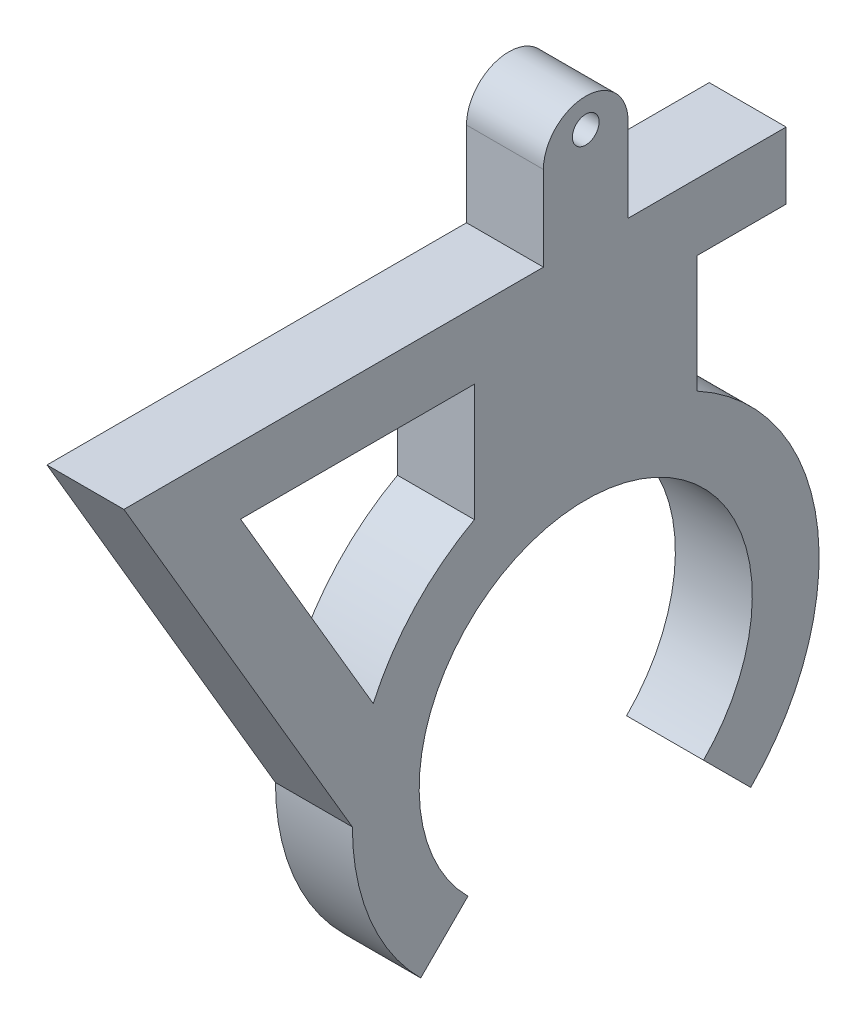
from build123d import *

# Parameters (mm, degrees)
SKETCH1_R           = 0.3
BOSS_EXTRUDE1_DEPTH = 1.7272


with BuildPart() as part:
    # Sketch1 → Boss-Extrude1 (new body)
    with BuildSketch(Plane(origin=(0, 0, 0), x_dir=(0, 0, -1), z_dir=(1, 0, 0))):
        with BuildLine():
            Line((-3.705239533, -3.705239533), (-2.644579362, -2.644579362))
            ThreePointArc((-2.644579362, -2.644579362), (0, 3.74), (2.644579362, -2.644579362))
            Line((2.644579362, -2.644579362), (3.705239533, -3.705239533))
            ThreePointArc((3.705239533, -3.705239533), (5.185747801, 0.752076956), (2.5, 4.605171007))
            Line((2.5, 4.605171007), (2.5, 7.24))
            Line((2.5, 7.24), (4.5, 7.24))
            Line((4.5, 7.24), (4.5, 8.74))
            Line((4.5, 8.74), (0.95, 8.74))
            Line((0.95, 8.74), (0.95, 10.64))
            ThreePointArc((0.95, 10.64), (0, 11.59), (-0.95, 10.64))
            Line((-0.95, 10.64), (-0.95, 8.74))
            Line((-0.95, 8.74), (-10.370093503, 8.74))
            Line((-10.370093503, 8.74), (-5.24, 0))
            ThreePointArc((-5.24, 0), (-4.84112875, -2.005261186), (-3.705239533, -3.705239533))
        make_face()
        with BuildLine():
            ThreePointArc((-2.5, 4.605171007), (-3.835037239, 3.570726729), (-4.771676297, 2.165341847))
            Line((-4.771676297, 2.165341847), (-7.750334287, 7.24))
            Line((-7.750334287, 7.24), (-2.5, 7.24))
            Line((-2.5, 7.24), (-2.5, 4.605171007))
        make_face(mode=Mode.SUBTRACT)
        with Locations((0, 10.94)):
            Circle(SKETCH1_R, mode=Mode.SUBTRACT)
    extrude(amount=BOSS_EXTRUDE1_DEPTH)


solid = part.part
